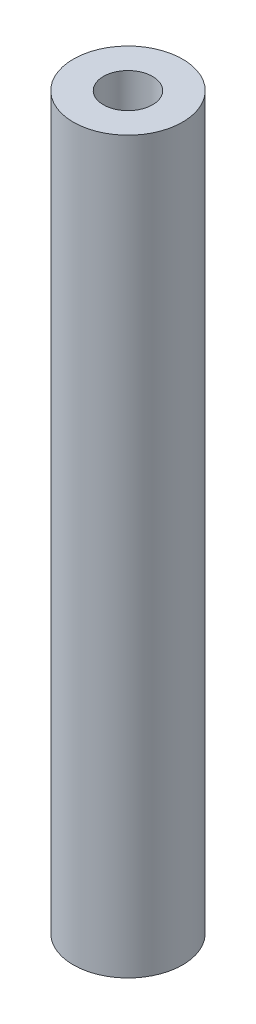
from build123d import *

# Parameters (mm, degrees)
SZKIC1_R                    = 5
SZKIC1_R_2                  = 2.25
DODANIE_WYCI_GNI_CIE1_DEPTH = 66.8


with BuildPart() as part:
    # Szkic1 → Dodanie-wyciągnięcie1 (new body)
    with BuildSketch(Plane(origin=(0, 0, 0), x_dir=(1, 0, 0), z_dir=(0, 1, 0))):
        with Locations((-3.443725343, 0)):
            Circle(SZKIC1_R)
        with Locations((-3.443725343, 0)):
            Circle(SZKIC1_R_2, mode=Mode.SUBTRACT)
    extrude(amount=DODANIE_WYCI_GNI_CIE1_DEPTH)


solid = part.part
